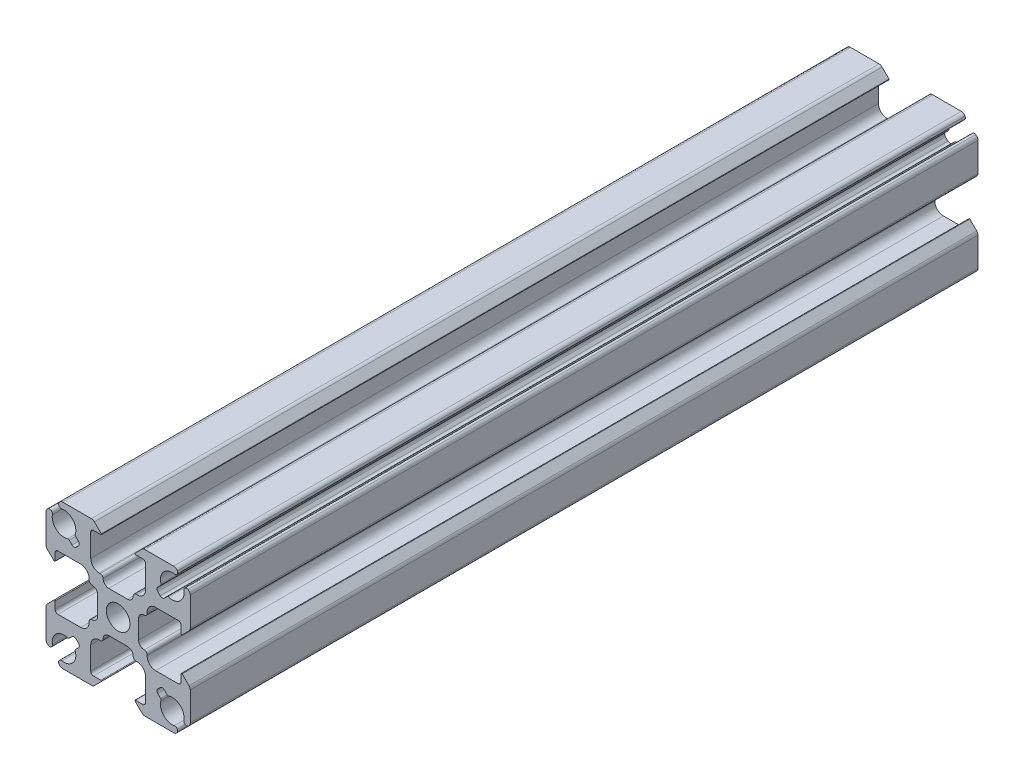
from build123d import *

# Parameters (mm, degrees)
SKETCH1_R                            = 2.08
BOSS_EXTRUDE1_DEPTH                  = 69.341494032
SKETCH2_W                            = 2.5
SKETCH2_H                            = 16.3
TAP_DRILL_FOR_M6X1_0_TAP1_AT_2_COUNT = 2
TAP_DRILL_FOR_M6X1_0_TAP1_AT_2_PITCH = 50.8


with BuildPart() as part:
    # Sketch1 → Boss-Extrude1 (new, symmetric)
    with BuildSketch(Plane(origin=(0, 0, 0), x_dir=(-1, 0, 0), z_dir=(0, 0, -1))):
        with BuildLine():
            Line((-7.48853247, 8.61990332), (-6.985643798, 8.117014648))
            ThreePointArc((-6.985643798, 8.117014648), (-6.839197188, 7.763461257), (-6.985643798, 7.409907866))
            Line((-6.985643798, 7.409907866), (-7.409907866, 6.985643798))
            ThreePointArc((-7.409907866, 6.985643798), (-7.763461257, 6.839197188), (-8.117014648, 6.985643798))
            Line((-8.117014648, 6.985643798), (-8.61990332, 7.48853247))
            ThreePointArc((-8.61990332, 7.48853247), (-8.738774884, 7.554957329), (-8.874825936, 7.549228331))
            ThreePointArc((-8.874825936, 7.549228331), (-10.889377278, 7.955008076), (-11.572136222, 9.893284252))
            ThreePointArc((-11.572136222, 9.893284252), (-11.766795458, 10.383720777), (-12.292708824, 10.42656157))
            ThreePointArc((-12.292708824, 10.42656157), (-12.590129525, 10.150252615), (-12.7, 9.759440396))
            Line((-12.7, 9.759440396), (-12.7, 4.710660172))
            ThreePointArc((-12.7, 4.710660172), (-12.642909649, 4.423647598), (-12.480330086, 4.180330086))
            Line((-12.480330086, 4.180330086), (-11.270710678, 2.970710678))
            ThreePointArc((-11.270710678, 2.970710678), (-11.161731657, 2.949033403), (-11.1, 3.041421356))
            Line((-11.1, 3.041421356), (-11.1, 4.325))
            ThreePointArc((-11.1, 4.325), (-10.953553391, 4.678553391), (-10.6, 4.825))
            Line((-10.6, 4.825), (-6.6, 4.825))
            ThreePointArc((-6.6, 4.825), (-5.539339828, 4.385660172), (-5.1, 3.325))
            Line((-5.1, 3.325), (-5.1, 3.15))
            ThreePointArc((-5.1, 3.15), (-4.953553391, 2.796446609), (-4.6, 2.65))
            ThreePointArc((-4.6, 2.65), (-3.892893219, 2.357106781), (-3.6, 1.65))
            Line((-3.6, 1.65), (-3.6, -1.65))
            ThreePointArc((-3.6, -1.65), (-3.892893219, -2.357106781), (-4.6, -2.65))
            ThreePointArc((-4.6, -2.65), (-4.953553391, -2.796446609), (-5.1, -3.15))
            Line((-5.1, -3.15), (-5.1, -3.325))
            ThreePointArc((-5.1, -3.325), (-5.539339828, -4.385660172), (-6.6, -4.825))
            Line((-6.6, -4.825), (-10.6, -4.825))
            ThreePointArc((-10.6, -4.825), (-10.953553391, -4.678553391), (-11.1, -4.325))
            Line((-11.1, -4.325), (-11.1, -3.041421356))
            ThreePointArc((-11.1, -3.041421356), (-11.161731657, -2.949033403), (-11.270710678, -2.970710678))
            Line((-11.270710678, -2.970710678), (-12.480330086, -4.180330086))
            ThreePointArc((-12.480330086, -4.180330086), (-12.642909649, -4.423647598), (-12.7, -4.710660172))
            Line((-12.7, -4.710660172), (-12.7, -9.759440396))
            ThreePointArc((-12.7, -9.759440396), (-12.590129525, -10.150252615), (-12.292708824, -10.42656157))
            ThreePointArc((-12.292708824, -10.42656157), (-11.766795458, -10.383720777), (-11.572136222, -9.893284252))
            ThreePointArc((-11.572136222, -9.893284252), (-10.889377278, -7.955008076), (-8.874825936, -7.549228331))
            ThreePointArc((-8.874825936, -7.549228331), (-8.738774884, -7.554957329), (-8.61990332, -7.48853247))
            Line((-8.61990332, -7.48853247), (-8.117014648, -6.985643798))
            ThreePointArc((-8.117014648, -6.985643798), (-7.763461257, -6.839197188), (-7.409907866, -6.985643798))
            Line((-7.409907866, -6.985643798), (-6.985643798, -7.409907866))
            ThreePointArc((-6.985643798, -7.409907866), (-6.839197188, -7.763461257), (-6.985643798, -8.117014648))
            Line((-6.985643798, -8.117014648), (-7.48853247, -8.61990332))
            ThreePointArc((-7.48853247, -8.61990332), (-7.554957329, -8.738774884), (-7.549228331, -8.874825936))
            ThreePointArc((-7.549228331, -8.874825936), (-7.955008076, -10.889377278), (-9.893284252, -11.572136222))
            ThreePointArc((-9.893284252, -11.572136222), (-10.383720777, -11.766795458), (-10.42656157, -12.292708824))
            ThreePointArc((-10.42656157, -12.292708824), (-10.150252615, -12.590129525), (-9.759440396, -12.7))
            Line((-9.759440396, -12.7), (-4.710660172, -12.7))
            ThreePointArc((-4.710660172, -12.7), (-4.423647598, -12.642909649), (-4.180330086, -12.480330086))
            Line((-4.180330086, -12.480330086), (-2.970710678, -11.270710678))
            ThreePointArc((-2.970710678, -11.270710678), (-2.949033403, -11.161731657), (-3.041421356, -11.1))
            Line((-3.041421356, -11.1), (-4.325, -11.1))
            ThreePointArc((-4.325, -11.1), (-4.678553391, -10.953553391), (-4.825, -10.6))
            Line((-4.825, -10.6), (-4.825, -6.6))
            ThreePointArc((-4.825, -6.6), (-4.385660172, -5.539339828), (-3.325, -5.1))
            Line((-3.325, -5.1), (-3.15, -5.1))
            ThreePointArc((-3.15, -5.1), (-2.796446609, -4.953553391), (-2.65, -4.6))
            ThreePointArc((-2.65, -4.6), (-2.357106781, -3.892893219), (-1.65, -3.6))
            Line((-1.65, -3.6), (1.65, -3.6))
            ThreePointArc((1.65, -3.6), (2.357106781, -3.892893219), (2.65, -4.6))
            ThreePointArc((2.65, -4.6), (2.796446609, -4.953553391), (3.15, -5.1))
            Line((3.15, -5.1), (3.325, -5.1))
            ThreePointArc((3.325, -5.1), (4.385660172, -5.539339828), (4.825, -6.6))
            Line((4.825, -6.6), (4.825, -10.6))
            ThreePointArc((4.825, -10.6), (4.678553391, -10.953553391), (4.325, -11.1))
            Line((4.325, -11.1), (3.041421356, -11.1))
            ThreePointArc((3.041421356, -11.1), (2.949033403, -11.161731657), (2.970710678, -11.270710678))
            Line((2.970710678, -11.270710678), (4.180330086, -12.480330086))
            ThreePointArc((4.180330086, -12.480330086), (4.423647598, -12.642909649), (4.710660172, -12.7))
            Line((4.710660172, -12.7), (9.759440396, -12.7))
            ThreePointArc((9.759440396, -12.7), (10.150252615, -12.590129525), (10.42656157, -12.292708824))
            ThreePointArc((10.42656157, -12.292708824), (10.383720777, -11.766795458), (9.893284252, -11.572136222))
            ThreePointArc((9.893284252, -11.572136222), (7.955008076, -10.889377278), (7.549228331, -8.874825936))
            ThreePointArc((7.549228331, -8.874825936), (7.554957329, -8.738774884), (7.48853247, -8.61990332))
            Line((7.48853247, -8.61990332), (6.985643798, -8.117014648))
            ThreePointArc((6.985643798, -8.117014648), (6.839197188, -7.763461257), (6.985643798, -7.409907866))
            Line((6.985643798, -7.409907866), (7.409907866, -6.985643798))
            ThreePointArc((7.409907866, -6.985643798), (7.763461257, -6.839197188), (8.117014648, -6.985643798))
            Line((8.117014648, -6.985643798), (8.61990332, -7.48853247))
            ThreePointArc((8.61990332, -7.48853247), (8.738774884, -7.554957329), (8.874825936, -7.549228331))
            ThreePointArc((8.874825936, -7.549228331), (10.889377278, -7.955008076), (11.572136222, -9.893284252))
            ThreePointArc((11.572136222, -9.893284252), (11.766795458, -10.383720777), (12.292708824, -10.42656157))
            ThreePointArc((12.292708824, -10.42656157), (12.590129525, -10.150252615), (12.7, -9.759440396))
            Line((12.7, -9.759440396), (12.7, -4.710660172))
            ThreePointArc((12.7, -4.710660172), (12.642909649, -4.423647598), (12.480330086, -4.180330086))
            Line((12.480330086, -4.180330086), (11.270710678, -2.970710678))
            ThreePointArc((11.270710678, -2.970710678), (11.161731657, -2.949033403), (11.1, -3.041421356))
            Line((11.1, -3.041421356), (11.1, -4.325))
            ThreePointArc((11.1, -4.325), (10.953553391, -4.678553391), (10.6, -4.825))
            Line((10.6, -4.825), (6.6, -4.825))
            ThreePointArc((6.6, -4.825), (5.539339828, -4.385660172), (5.1, -3.325))
            Line((5.1, -3.325), (5.1, -3.15))
            ThreePointArc((5.1, -3.15), (4.953553391, -2.796446609), (4.6, -2.65))
            ThreePointArc((4.6, -2.65), (3.892893219, -2.357106781), (3.6, -1.65))
            Line((3.6, -1.65), (3.6, 1.65))
            ThreePointArc((3.6, 1.65), (3.892893219, 2.357106781), (4.6, 2.65))
            ThreePointArc((4.6, 2.65), (4.953553391, 2.796446609), (5.1, 3.15))
            Line((5.1, 3.15), (5.1, 3.325))
            ThreePointArc((5.1, 3.325), (5.539339828, 4.385660172), (6.6, 4.825))
            Line((6.6, 4.825), (10.6, 4.825))
            ThreePointArc((10.6, 4.825), (10.953553391, 4.678553391), (11.1, 4.325))
            Line((11.1, 4.325), (11.1, 3.041421356))
            ThreePointArc((11.1, 3.041421356), (11.161731657, 2.949033403), (11.270710678, 2.970710678))
            Line((11.270710678, 2.970710678), (12.480330086, 4.180330086))
            ThreePointArc((12.480330086, 4.180330086), (12.642909649, 4.423647598), (12.7, 4.710660172))
            Line((12.7, 4.710660172), (12.7, 9.759440396))
            ThreePointArc((12.7, 9.759440396), (12.590129525, 10.150252615), (12.292708824, 10.42656157))
            ThreePointArc((12.292708824, 10.42656157), (11.766795458, 10.383720777), (11.572136222, 9.893284252))
            ThreePointArc((11.572136222, 9.893284252), (10.889377278, 7.955008076), (8.874825936, 7.549228331))
            ThreePointArc((8.874825936, 7.549228331), (8.738774884, 7.554957329), (8.61990332, 7.48853247))
            Line((8.61990332, 7.48853247), (8.117014648, 6.985643798))
            ThreePointArc((8.117014648, 6.985643798), (7.763461257, 6.839197188), (7.409907866, 6.985643798))
            Line((7.409907866, 6.985643798), (6.985643798, 7.409907866))
            ThreePointArc((6.985643798, 7.409907866), (6.839197188, 7.763461257), (6.985643798, 8.117014648))
            Line((6.985643798, 8.117014648), (7.48853247, 8.61990332))
            ThreePointArc((7.48853247, 8.61990332), (7.554957329, 8.738774884), (7.549228331, 8.874825936))
            ThreePointArc((7.549228331, 8.874825936), (7.955008076, 10.889377278), (9.893284252, 11.572136222))
            ThreePointArc((9.893284252, 11.572136222), (10.383720777, 11.766795458), (10.42656157, 12.292708824))
            ThreePointArc((10.42656157, 12.292708824), (10.150252615, 12.590129525), (9.759440396, 12.7))
            Line((9.759440396, 12.7), (4.710660172, 12.7))
            ThreePointArc((4.710660172, 12.7), (4.423647598, 12.642909649), (4.180330086, 12.480330086))
            Line((4.180330086, 12.480330086), (2.970710678, 11.270710678))
            ThreePointArc((2.970710678, 11.270710678), (2.949033403, 11.161731657), (3.041421356, 11.1))
            Line((3.041421356, 11.1), (4.325, 11.1))
            ThreePointArc((4.325, 11.1), (4.678553391, 10.953553391), (4.825, 10.6))
            Line((4.825, 10.6), (4.825, 6.6))
            ThreePointArc((4.825, 6.6), (4.385660172, 5.539339828), (3.325, 5.1))
            Line((3.325, 5.1), (3.15, 5.1))
            ThreePointArc((3.15, 5.1), (2.796446609, 4.953553391), (2.65, 4.6))
            ThreePointArc((2.65, 4.6), (2.357106781, 3.892893219), (1.65, 3.6))
            Line((1.65, 3.6), (-1.65, 3.6))
            ThreePointArc((-1.65, 3.6), (-2.357106781, 3.892893219), (-2.65, 4.6))
            ThreePointArc((-2.65, 4.6), (-2.796446609, 4.953553391), (-3.15, 5.1))
            Line((-3.15, 5.1), (-3.325, 5.1))
            ThreePointArc((-3.325, 5.1), (-4.385660172, 5.539339828), (-4.825, 6.6))
            Line((-4.825, 6.6), (-4.825, 10.6))
            ThreePointArc((-4.825, 10.6), (-4.678553391, 10.953553391), (-4.325, 11.1))
            Line((-4.325, 11.1), (-3.041421356, 11.1))
            ThreePointArc((-3.041421356, 11.1), (-2.949033403, 11.161731657), (-2.970710678, 11.270710678))
            Line((-2.970710678, 11.270710678), (-4.180330086, 12.480330086))
            ThreePointArc((-4.180330086, 12.480330086), (-4.423647598, 12.642909649), (-4.710660172, 12.7))
            Line((-4.710660172, 12.7), (-9.759440396, 12.7))
            ThreePointArc((-9.759440396, 12.7), (-10.150252615, 12.590129525), (-10.42656157, 12.292708824))
            ThreePointArc((-10.42656157, 12.292708824), (-10.383720777, 11.766795458), (-9.893284252, 11.572136222))
            ThreePointArc((-9.893284252, 11.572136222), (-7.955008076, 10.889377278), (-7.549228331, 8.874825936))
            ThreePointArc((-7.549228331, 8.874825936), (-7.554957329, 8.738774884), (-7.48853247, 8.61990332))
        make_face()
        Circle(SKETCH1_R, mode=Mode.SUBTRACT)
    extrude(amount=BOSS_EXTRUDE1_DEPTH, both=True)

    # Sketch2 → Tap Drill for M6x1.0 Tap1 (revolve, cut)
    with BuildSketch(Plane(origin=(0, 3.6, 56.641494032), x_dir=(0, 0, 1), z_dir=(1, 0, 0))):
        with Locations((1.25, 8.15)):
            Rectangle(SKETCH2_W, SKETCH2_H)
    tap_drill_for_m6x1_0_tap1 = revolve(axis=Axis((0, 9.95, 56.641494032), (0, -1, 0)), mode=Mode.SUBTRACT)

    # Tap Drill for M6x1.0 Tap1 at 2: Tap Drill for M6x1.0 Tap1 ×2
    with Locations(*[(0, 0, -i * TAP_DRILL_FOR_M6X1_0_TAP1_AT_2_PITCH) for i in range(1, TAP_DRILL_FOR_M6X1_0_TAP1_AT_2_COUNT)]):
        add(tap_drill_for_m6x1_0_tap1, mode=Mode.SUBTRACT)


solid = part.part
